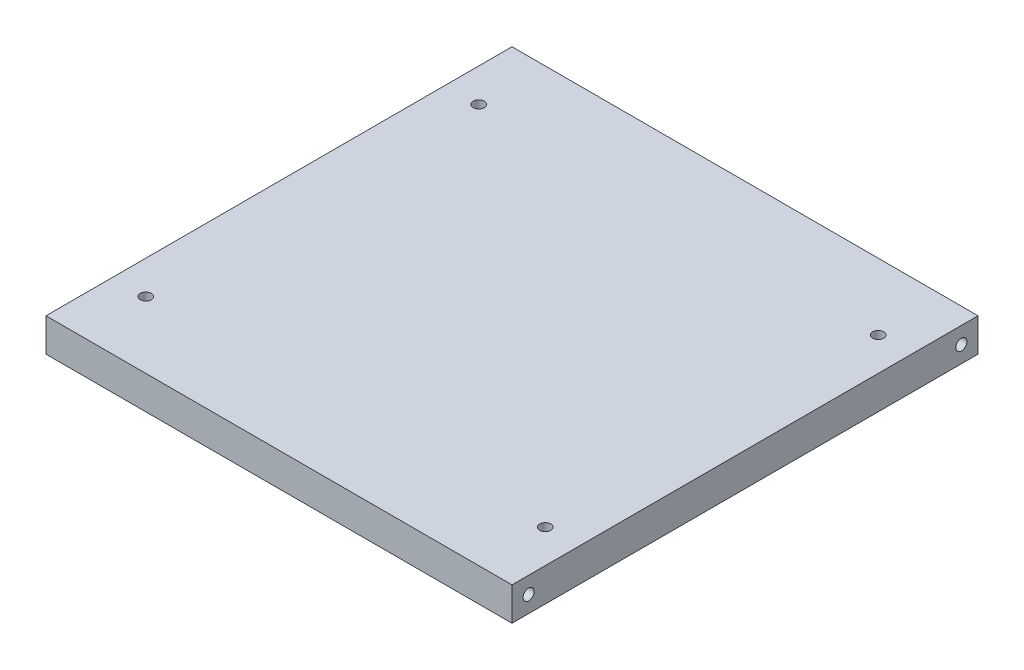
from build123d import *

# Parameters (mm, degrees)
SKETCH1_W            = 84
SKETCH1_H            = 84
BOSS_EXTRUDE1_DEPTH  = 6
SKETCH2_R            = 1
CUT_EXTRUDE1_DEPTH   = 6
LPATTERN1_COUNT      = 2
LPATTERN1_PITCH      = 72
LPATTERN1_COUNT_DIR2 = 2
LPATTERN1_PITCH_DIR2 = 60
SKETCH3_R            = 1
CUT_EXTRUDE2_DEPTH   = 10


with BuildPart() as part:
    # Sketch1 → Boss-Extrude1 (new body)
    with BuildSketch(Plane(origin=(0, 0, 0), x_dir=(1, 0, 0), z_dir=(0, 1, 0))):
        with Locations((42, 42)):
            Rectangle(SKETCH1_W, SKETCH1_H)
    extrude(amount=BOSS_EXTRUDE1_DEPTH)

    # Sketch2 → Cut-Extrude1 (cut)
    with BuildSketch(Plane(origin=(0, 6, 0), x_dir=(1, 0, 0), z_dir=(0, 1, 0))):
        with Locations((6, 72)):
            Circle(SKETCH2_R)
    cut_extrude1 = extrude(amount=-CUT_EXTRUDE1_DEPTH, mode=Mode.SUBTRACT)

    # LPattern1: Cut-Extrude1 2 × 2
    with Locations(*[(i * LPATTERN1_PITCH, 0, j * LPATTERN1_PITCH_DIR2) for i in range(LPATTERN1_COUNT) for j in range(LPATTERN1_COUNT_DIR2) if (i, j) != (0, 0)]):
        add(cut_extrude1, mode=Mode.SUBTRACT)

    # Sketch3 → Cut-Extrude2 (cut)
    with BuildSketch(Plane.ZY):
        with Locations((-81, 3)):
            Circle(SKETCH3_R)
        with Locations((-3, 3)):
            Circle(SKETCH3_R)
    cut_extrude2 = extrude(amount=-CUT_EXTRUDE2_DEPTH, mode=Mode.SUBTRACT)

    # Mirror1: Cut-Extrude2 across plane
    add(cut_extrude2.mirror(Plane.ZY.offset(-42)), mode=Mode.SUBTRACT)


solid = part.part
